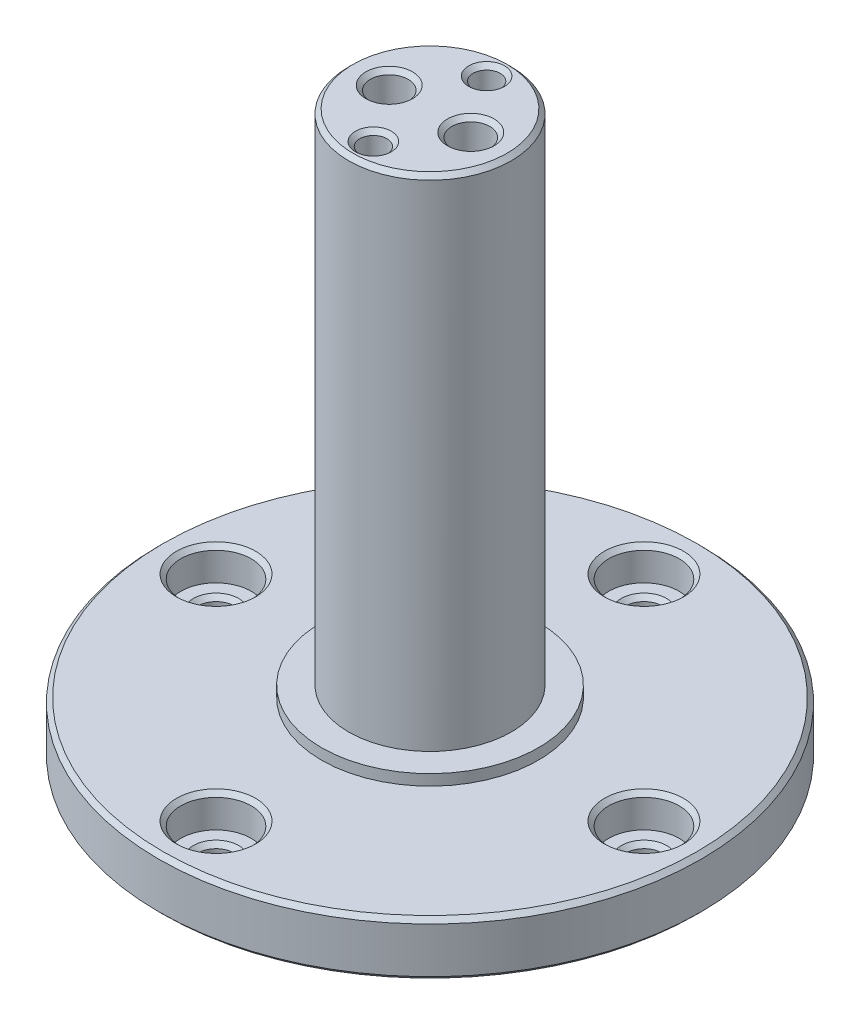
from build123d import *

# Parameters (mm, degrees)
CIRPATTERN1_COUNT                               = 4
CUT_EXTRUDE1_DEPTH                              = 47
SKETCH6_R                                       = 1.75
CUT_EXTRUDE2_DEPTH                              = 59.81326381
CSK_FOR_M3_FLAT_HEAD_MACHINE_SCREW1_D           = 2.5
CSK_FOR_M3_FLAT_HEAD_MACHINE_SCREW1_CSINK_D     = 6.5
CSK_FOR_M3_FLAT_HEAD_MACHINE_SCREW1_CSINK_ANGLE = 90
CHAMFER1_SIZE                                   = 0.4


# Some blends are built 0.0001 mm under size
with BuildPart() as part:
    # Sketch1 → Revolve1 (revolve)
    with BuildSketch(Plane.XY, mode=Mode.PRIVATE) as revolve1_sk:
        Polygon((0, 0), (25, 0), (25, 5), (10, 5), (10, 6), (7.5, 6), (7.5, 52), (0, 52), align=None)
    revolve(revolve1_sk.sketch.rotate(Axis((0, 52, 0), (0, -1, 0)), 90), axis=Axis((0, 52, 0), (0, -1, 0)))

    # Sketch4 → CBORE for M3 SHCS1 (revolve, cut)
    with BuildSketch(Plane(origin=(-19.7225, 5, 0), x_dir=(0, 0, 1), z_dir=(1, 0, 0))):
        Polygon((0, 0), (0, 5), (2.1, 5), (1.7, 4.6), (1.7, 3.4), (2.1, 3), (3.25, 3), (3.25, 0.4), (3.65, 0), align=None)
    cbore_for_m3_shcs1 = revolve(axis=Axis((-19.7225, 11.35, 0), (0, -1, 0)), mode=Mode.SUBTRACT)

    # CirPattern1: CBORE for M3 SHCS1 ×4 about axis
    cirpattern1_axis = Axis((0, 0, 0), (0, 1, 0))
    for i in range(1, CIRPATTERN1_COUNT):
        add(cbore_for_m3_shcs1.rotate(cirpattern1_axis, i * 360 / CIRPATTERN1_COUNT), mode=Mode.SUBTRACT)

    # Sketch5 → Cut-Extrude1 (cut)
    with BuildSketch(Plane.XZ):
        Polygon((-1.009160212, -1.58771324), (-1.009160212, 1.58771324), (-3.759160212, 3.175426481), (-6.509160212, 1.58771324), (-6.509160212, -1.58771324), (-3.759160212, -3.175426481), align=None)
        Polygon((3.759160212, 3.175426481), (1.009160212, 1.58771324), (1.009160212, -1.58771324), (3.759160212, -3.175426481), (6.509160212, -1.58771324), (6.509160212, 1.58771324), align=None)
    extrude(amount=-CUT_EXTRUDE1_DEPTH, mode=Mode.SUBTRACT)

    # Sketch6 → Cut-Extrude2 (cut, through all)
    with BuildSketch(Plane.XZ.offset(-47)):
        with Locations(Location((3.759160212, 0, 0), (0, 0, 270))):
            Circle(SKETCH6_R)
        with Locations(Location((-3.759160212, 0, 0), (0, 0, 270))):
            Circle(SKETCH6_R)
    extrude(amount=-CUT_EXTRUDE2_DEPTH, mode=Mode.SUBTRACT)

    # CSK for M3 Flat Head Machine Screw1 (through all)
    with Locations(Plane(origin=(0, 0, 0), x_dir=(-1, 0, 0), z_dir=(0, -1, 0))):
        with Locations((0, -5.219731285), (0, 5.219731285)):
            CounterSinkHole(CSK_FOR_M3_FLAT_HEAD_MACHINE_SCREW1_D / 2, CSK_FOR_M3_FLAT_HEAD_MACHINE_SCREW1_CSINK_D / 2, counter_sink_angle=CSK_FOR_M3_FLAT_HEAD_MACHINE_SCREW1_CSINK_ANGLE)

    # Chamfer1
    chamfer1_edges = [part.edges().sort_by_distance(p)[0] for p in [
        (-3.759160212, 52, 1.75),
        (-1.25, 52, -5.219731285),
        (-1.25, 52, 5.219731285),
        (-2.384160212, 0, -2.38156986),
        (0, 52, -7.5),
        (-1.009160212, 0, 0),
        (-2.384160212, 0, 2.38156986),
        (-5.134160212, 0, 2.38156986),
        (-6.509160212, 0, 0),
        (-5.134160212, 0, -2.38156986),
        (5.134160212, 0, 2.38156986),
        (2.384160212, 0, 2.38156986),
        (1.009160212, 0, 0),
        (2.384160212, 0, -2.38156986),
        (5.134160212, 0, -2.38156986),
        (6.509160212, 0, 0),
        (0, 5, -25),
        (0, 0, -25),
        (3.759160212, 52, 1.75),
    ]]
    chamfer(chamfer1_edges, length=CHAMFER1_SIZE - 0.0001)  # a hair under: the kernel refuses the full size

    # Chamfer2
    # the kernel refuses this chamfer: 1.6 mm, written as the material it adds along each edge
    with BuildSketch(Plane(origin=(-10.072588689, 47, 0.46963315), x_dir=(-0.013747938305293285, -0.9996219169112966, -0.02381212764409033), z_dir=(0.8660254037844386, 0, -0.5000000000000002))) as chamfer2_piece_1_section:
        with BuildLine():
            Line((1.645877112, 0), (-0.090475448, -1.64338847))
            Line((-0.090475448, -1.64338847), (-0.122463349, -1.642508602))
            ThreePointArc((-0.122463349, -1.642508602), (-0.054606763, -0.821436527), (-0.031987901, 0.000879868))
            Line((-0.031987901, 0.000879868), (0.000879868, 0.031987901))
            ThreePointArc((0.000879868, 0.031987901), (0.823196264, 0.009369039), (1.64675698, 0.031987901))
            Line((1.64675698, 0.031987901), (1.645877112, 0))
        make_face()
    chamfer2_piece_1 = extrude(amount=11.404812042, mode=Mode.PRIVATE)
    chamfer2_piece_1 = split(chamfer2_piece_1, bisect_by=Plane(origin=(-4.04949451, 46.473901725, -3.343051066), z_dir=(-0.49999999999999994, 0, 0.8660254037844389)), keep=Keep.TOP, mode=Mode.PRIVATE)
    chamfer2_piece_1 = split(chamfer2_piece_1, bisect_by=Plane(origin=(-6.509160212, 46.473901725, -1.922962404), z_dir=(1, 0, 0)), keep=Keep.TOP, mode=Mode.PRIVATE)
    chamfer2_piece_1 = chamfer2_piece_1 - Plane(origin=(-3.759160212, 46.473901725, 0), x_dir=(0, 0, -1), z_dir=(0, -1, 0)) * Cylinder(1.75, 30, mode=Mode.PRIVATE)
    add(chamfer2_piece_1)
    with BuildSketch(Plane(origin=(-6.509160212, 47, 5.702406021), x_dir=(-0.027495876610586223, -0.9996219169112966, 0), z_dir=(0, 0, -1))) as chamfer2_piece_2_section:
        with BuildLine():
            Line((1.645877112, 0), (-0.090475448, -1.64338847))
            Line((-0.090475448, -1.64338847), (-0.122463349, -1.642508602))
            ThreePointArc((-0.122463349, -1.642508602), (-0.054606763, -0.821436527), (-0.031987901, 0.000879868))
            Line((-0.031987901, 0.000879868), (0.000879868, 0.031987901))
            ThreePointArc((0.000879868, 0.031987901), (0.823196264, 0.009369039), (1.64675698, 0.031987901))
            Line((1.64675698, 0.031987901), (1.645877112, 0))
        make_face()
    chamfer2_piece_2 = extrude(amount=11.404812042, mode=Mode.PRIVATE)
    chamfer2_piece_2 = split(chamfer2_piece_2, bisect_by=Plane(origin=(-6.799494523, 46.473901712, -1.420088648), z_dir=(0.5000000000000002, 0, 0.8660254037844386)), keep=Keep.TOP, mode=Mode.PRIVATE)
    chamfer2_piece_2 = split(chamfer2_piece_2, bisect_by=Plane(origin=(-6.799494522, 46.473901712, 1.420088648), z_dir=(0.4999999999999998, 0, -0.8660254037844388)), keep=Keep.TOP, mode=Mode.PRIVATE)
    chamfer2_piece_2 = chamfer2_piece_2 - Plane(origin=(-3.759160212, 46.473901712, 0), x_dir=(0, 0, -1), z_dir=(0, -1, 0)) * Cylinder(1.75, 30, mode=Mode.PRIVATE)
    add(chamfer2_piece_2)
    with BuildSketch(Plane(origin=(-0.195731735, 47, 5.232772871), x_dir=(-0.01374793830529322, -0.9996219169112966, 0.023812127644090242), z_dir=(-0.8660254037844388, 0, -0.4999999999999998))) as chamfer2_piece_3_section:
        with BuildLine():
            Line((1.645877112, 0), (-0.090475448, -1.64338847))
            Line((-0.090475448, -1.64338847), (-0.122463349, -1.642508602))
            ThreePointArc((-0.122463349, -1.642508602), (-0.054606763, -0.821436527), (-0.031987901, 0.000879868))
            Line((-0.031987901, 0.000879868), (0.000879868, 0.031987901))
            ThreePointArc((0.000879868, 0.031987901), (0.823196264, 0.009369039), (1.64675698, 0.031987901))
            Line((1.64675698, 0.031987901), (1.645877112, 0))
        make_face()
    chamfer2_piece_3 = extrude(amount=11.404812042, mode=Mode.PRIVATE)
    chamfer2_piece_3 = split(chamfer2_piece_3, bisect_by=Plane(origin=(-6.509160212, 46.473901712, 1.922962425), z_dir=(1, 0, 0)), keep=Keep.TOP, mode=Mode.PRIVATE)
    chamfer2_piece_3 = split(chamfer2_piece_3, bisect_by=Plane(origin=(-4.049494522, 46.473901712, 3.343051072), z_dir=(-0.5000000000000003, 0, -0.8660254037844386)), keep=Keep.TOP, mode=Mode.PRIVATE)
    chamfer2_piece_3 = chamfer2_piece_3 - Plane(origin=(-3.759160212, 46.473901712, 0), x_dir=(0, 0, -1), z_dir=(0, -1, 0)) * Cylinder(1.75, 30, mode=Mode.PRIVATE)
    add(chamfer2_piece_3)
    with BuildSketch(Plane(origin=(-7.322588689, 47, -5.232772871), x_dir=(0.013747938305293349, -0.9996219169112966, -0.023812127644090457), z_dir=(0.8660254037844387, 0, 0.49999999999999983))) as chamfer2_piece_4_section:
        with BuildLine():
            Line((1.645877112, 0), (-0.090475448, -1.64338847))
            Line((-0.090475448, -1.64338847), (-0.122463349, -1.642508602))
            ThreePointArc((-0.122463349, -1.642508602), (-0.054606763, -0.821436527), (-0.031987901, 0.000879868))
            Line((-0.031987901, 0.000879868), (0.000879868, 0.031987901))
            ThreePointArc((0.000879868, 0.031987901), (0.823196264, 0.009369039), (1.64675698, 0.031987901))
            Line((1.64675698, 0.031987901), (1.645877112, 0))
        make_face()
    chamfer2_piece_4 = extrude(amount=11.404812042, mode=Mode.PRIVATE)
    chamfer2_piece_4 = split(chamfer2_piece_4, bisect_by=Plane(origin=(-3.468825909, 46.473901717, -3.343051069), z_dir=(0.5000000000000002, 0, 0.8660254037844386)), keep=Keep.TOP, mode=Mode.PRIVATE)
    chamfer2_piece_4 = split(chamfer2_piece_4, bisect_by=Plane(origin=(-1.009160212, 46.473901717, -1.922962418), z_dir=(-1, 0, 0)), keep=Keep.TOP, mode=Mode.PRIVATE)
    chamfer2_piece_4 = chamfer2_piece_4 - Plane(origin=(-3.759160212, 46.473901717, 0), x_dir=(0, 0, -1), z_dir=(0, -1, 0)) * Cylinder(1.75, 30, mode=Mode.PRIVATE)
    add(chamfer2_piece_4)
    with BuildSketch(Plane(origin=(2.554268265, 47, -0.46963315), x_dir=(0.013747938305293157, -0.9996219169112966, 0.0238121276440901), z_dir=(-0.8660254037844386, 0, 0.5000000000000003))) as chamfer2_piece_5_section:
        with BuildLine():
            Line((1.645877112, 0), (-0.090475448, -1.64338847))
            Line((-0.090475448, -1.64338847), (-0.122463349, -1.642508602))
            ThreePointArc((-0.122463349, -1.642508602), (-0.054606763, -0.821436527), (-0.031987901, 0.000879868))
            Line((-0.031987901, 0.000879868), (0.000879868, 0.031987901))
            ThreePointArc((0.000879868, 0.031987901), (0.823196264, 0.009369039), (1.64675698, 0.031987901))
            Line((1.64675698, 0.031987901), (1.645877112, 0))
        make_face()
    chamfer2_piece_5 = extrude(amount=11.404812042, mode=Mode.PRIVATE)
    chamfer2_piece_5 = split(chamfer2_piece_5, bisect_by=Plane(origin=(-1.009160212, 46.473901712, 1.922962424), z_dir=(-1, 0, 0)), keep=Keep.TOP, mode=Mode.PRIVATE)
    chamfer2_piece_5 = split(chamfer2_piece_5, bisect_by=Plane(origin=(-3.468825902, 46.473901712, 3.343051073), z_dir=(0.4999999999999998, 0, -0.8660254037844388)), keep=Keep.TOP, mode=Mode.PRIVATE)
    chamfer2_piece_5 = chamfer2_piece_5 - Plane(origin=(-3.759160212, 46.473901712, 0), x_dir=(0, 0, -1), z_dir=(0, -1, 0)) * Cylinder(1.75, 30, mode=Mode.PRIVATE)
    add(chamfer2_piece_5)
    with BuildSketch(Plane(origin=(-1.009160212, 47, -5.702406021), x_dir=(0.02749587661058629, -0.9996219169112966, 0), z_dir=(0, 0, 1))) as chamfer2_piece_6_section:
        with BuildLine():
            Line((1.645877112, 0), (-0.090475448, -1.64338847))
            Line((-0.090475448, -1.64338847), (-0.122463349, -1.642508602))
            ThreePointArc((-0.122463349, -1.642508602), (-0.054606763, -0.821436527), (-0.031987901, 0.000879868))
            Line((-0.031987901, 0.000879868), (0.000879868, 0.031987901))
            ThreePointArc((0.000879868, 0.031987901), (0.823196264, 0.009369039), (1.64675698, 0.031987901))
            Line((1.64675698, 0.031987901), (1.645877112, 0))
        make_face()
    chamfer2_piece_6 = extrude(amount=11.404812042, mode=Mode.PRIVATE)
    chamfer2_piece_6 = split(chamfer2_piece_6, bisect_by=Plane(origin=(-0.718825902, 46.473901712, -1.420088648), z_dir=(-0.49999999999999994, 0, 0.8660254037844389)), keep=Keep.TOP, mode=Mode.PRIVATE)
    chamfer2_piece_6 = split(chamfer2_piece_6, bisect_by=Plane(origin=(-0.718825902, 46.473901712, 1.420088648), z_dir=(-0.5000000000000003, 0, -0.8660254037844386)), keep=Keep.TOP, mode=Mode.PRIVATE)
    chamfer2_piece_6 = chamfer2_piece_6 - Plane(origin=(-3.759160212, 46.473901712, 0), x_dir=(0, 0, -1), z_dir=(0, -1, 0)) * Cylinder(1.75, 30, mode=Mode.PRIVATE)
    add(chamfer2_piece_6)
    with BuildSketch(Plane(origin=(1.009160212, 47, 5.702406021), x_dir=(-0.02749587661058629, -0.9996219169112966, 0), z_dir=(0, 0, -1))) as chamfer2_piece_7_section:
        with BuildLine():
            Line((1.645877112, 0), (-0.090475448, -1.64338847))
            Line((-0.090475448, -1.64338847), (-0.122463349, -1.642508602))
            ThreePointArc((-0.122463349, -1.642508602), (-0.054606763, -0.821436527), (-0.031987901, 0.000879868))
            Line((-0.031987901, 0.000879868), (0.000879868, 0.031987901))
            ThreePointArc((0.000879868, 0.031987901), (0.823196264, 0.009369039), (1.64675698, 0.031987901))
            Line((1.64675698, 0.031987901), (1.645877112, 0))
        make_face()
    chamfer2_piece_7 = extrude(amount=11.404812042, mode=Mode.PRIVATE)
    chamfer2_piece_7 = split(chamfer2_piece_7, bisect_by=Plane(origin=(0.718825902, 46.473901712, 1.420088648), z_dir=(0.49999999999999967, 0, -0.8660254037844388)), keep=Keep.TOP, mode=Mode.PRIVATE)
    chamfer2_piece_7 = split(chamfer2_piece_7, bisect_by=Plane(origin=(0.718825902, 46.473901712, -1.420088648), z_dir=(0.5000000000000003, 0, 0.8660254037844385)), keep=Keep.TOP, mode=Mode.PRIVATE)
    chamfer2_piece_7 = chamfer2_piece_7 - Plane(origin=(3.759160212, 46.473901712, 0), x_dir=(0, 0, -1), z_dir=(0, -1, 0)) * Cylinder(1.75, 30, mode=Mode.PRIVATE)
    add(chamfer2_piece_7)
    with BuildSketch(Plane(origin=(7.322588689, 47, 5.232772871), x_dir=(-0.013747938305293347, -0.9996219169112966, 0.023812127644090464), z_dir=(-0.8660254037844389, 0, -0.4999999999999998))) as chamfer2_piece_8_section:
        with BuildLine():
            Line((1.645877112, 0), (-0.090475448, -1.64338847))
            Line((-0.090475448, -1.64338847), (-0.122463349, -1.642508602))
            ThreePointArc((-0.122463349, -1.642508602), (-0.054606763, -0.821436527), (-0.031987901, 0.000879868))
            Line((-0.031987901, 0.000879868), (0.000879868, 0.031987901))
            ThreePointArc((0.000879868, 0.031987901), (0.823196264, 0.009369039), (1.64675698, 0.031987901))
            Line((1.64675698, 0.031987901), (1.645877112, 0))
        make_face()
    chamfer2_piece_8 = extrude(amount=11.404812042, mode=Mode.PRIVATE)
    chamfer2_piece_8 = split(chamfer2_piece_8, bisect_by=Plane(origin=(3.468825902, 46.473901712, 3.343051072), z_dir=(-0.5000000000000002, 0, -0.8660254037844386)), keep=Keep.TOP, mode=Mode.PRIVATE)
    chamfer2_piece_8 = split(chamfer2_piece_8, bisect_by=Plane(origin=(1.009160212, 46.473901712, 1.922962425), z_dir=(1, 0, 0)), keep=Keep.TOP, mode=Mode.PRIVATE)
    chamfer2_piece_8 = chamfer2_piece_8 - Plane(origin=(3.759160212, 46.473901712, 0), x_dir=(0, 0, -1), z_dir=(0, -1, 0)) * Cylinder(1.75, 30, mode=Mode.PRIVATE)
    add(chamfer2_piece_8)
    with BuildSketch(Plane(origin=(10.072588689, 47, -0.46963315), x_dir=(0.01374793830529317, -0.9996219169112966, 0.023812127644090124), z_dir=(-0.8660254037844386, 0, 0.5000000000000002))) as chamfer2_piece_9_section:
        with BuildLine():
            Line((1.645877112, 0), (-0.090475448, -1.64338847))
            Line((-0.090475448, -1.64338847), (-0.122463349, -1.642508602))
            ThreePointArc((-0.122463349, -1.642508602), (-0.054606763, -0.821436527), (-0.031987901, 0.000879868))
            Line((-0.031987901, 0.000879868), (0.000879868, 0.031987901))
            ThreePointArc((0.000879868, 0.031987901), (0.823196264, 0.009369039), (1.64675698, 0.031987901))
            Line((1.64675698, 0.031987901), (1.645877112, 0))
        make_face()
    chamfer2_piece_9 = extrude(amount=11.404812042, mode=Mode.PRIVATE)
    chamfer2_piece_9 = split(chamfer2_piece_9, bisect_by=Plane(origin=(6.509160212, 46.473901712, 1.922962424), z_dir=(-1, 0, 0)), keep=Keep.TOP, mode=Mode.PRIVATE)
    chamfer2_piece_9 = split(chamfer2_piece_9, bisect_by=Plane(origin=(4.049494523, 46.473901712, 3.343051073), z_dir=(0.49999999999999967, 0, -0.8660254037844388)), keep=Keep.TOP, mode=Mode.PRIVATE)
    chamfer2_piece_9 = chamfer2_piece_9 - Plane(origin=(3.759160212, 46.473901712, 0), x_dir=(0, 0, -1), z_dir=(0, -1, 0)) * Cylinder(1.75, 30, mode=Mode.PRIVATE)
    add(chamfer2_piece_9)
    with BuildSketch(Plane(origin=(6.509160212, 47, -5.702406021), x_dir=(0.027495876610586223, -0.9996219169112966, 0), z_dir=(0, 0, 1))) as chamfer2_piece_10_section:
        with BuildLine():
            Line((1.645877112, 0), (-0.090475448, -1.64338847))
            Line((-0.090475448, -1.64338847), (-0.122463349, -1.642508602))
            ThreePointArc((-0.122463349, -1.642508602), (-0.054606763, -0.821436527), (-0.031987901, 0.000879868))
            Line((-0.031987901, 0.000879868), (0.000879868, 0.031987901))
            ThreePointArc((0.000879868, 0.031987901), (0.823196264, 0.009369039), (1.64675698, 0.031987901))
            Line((1.64675698, 0.031987901), (1.645877112, 0))
        make_face()
    chamfer2_piece_10 = extrude(amount=11.404812042, mode=Mode.PRIVATE)
    chamfer2_piece_10 = split(chamfer2_piece_10, bisect_by=Plane(origin=(6.799494523, 46.473901712, 1.420088648), z_dir=(-0.5000000000000002, 0, -0.8660254037844386)), keep=Keep.TOP, mode=Mode.PRIVATE)
    chamfer2_piece_10 = split(chamfer2_piece_10, bisect_by=Plane(origin=(6.799494522, 46.473901712, -1.420088648), z_dir=(-0.49999999999999967, 0, 0.8660254037844389)), keep=Keep.TOP, mode=Mode.PRIVATE)
    chamfer2_piece_10 = chamfer2_piece_10 - Plane(origin=(3.759160212, 46.473901712, 0), x_dir=(0, 0, -1), z_dir=(0, -1, 0)) * Cylinder(1.75, 30, mode=Mode.PRIVATE)
    add(chamfer2_piece_10)
    with BuildSketch(Plane(origin=(0.195731735, 47, -5.232772871), x_dir=(0.013747938305293082, -0.9996219169112966, -0.023812127644090013), z_dir=(0.8660254037844389, 0, 0.49999999999999967))) as chamfer2_piece_11_section:
        with BuildLine():
            Line((1.645877112, 0), (-0.090475448, -1.64338847))
            Line((-0.090475448, -1.64338847), (-0.122463349, -1.642508602))
            ThreePointArc((-0.122463349, -1.642508602), (-0.054606763, -0.821436527), (-0.031987901, 0.000879868))
            Line((-0.031987901, 0.000879868), (0.000879868, 0.031987901))
            ThreePointArc((0.000879868, 0.031987901), (0.823196264, 0.009369039), (1.64675698, 0.031987901))
            Line((1.64675698, 0.031987901), (1.645877112, 0))
        make_face()
    chamfer2_piece_11 = extrude(amount=11.404812042, mode=Mode.PRIVATE)
    chamfer2_piece_11 = split(chamfer2_piece_11, bisect_by=Plane(origin=(6.509160212, 46.473901717, -1.922962418), z_dir=(-1, 0, 0)), keep=Keep.TOP, mode=Mode.PRIVATE)
    chamfer2_piece_11 = split(chamfer2_piece_11, bisect_by=Plane(origin=(4.049494515, 46.473901717, -3.343051069), z_dir=(0.5000000000000003, 0, 0.8660254037844385)), keep=Keep.TOP, mode=Mode.PRIVATE)
    chamfer2_piece_11 = chamfer2_piece_11 - Plane(origin=(3.759160212, 46.473901717, 0), x_dir=(0, 0, -1), z_dir=(0, -1, 0)) * Cylinder(1.75, 30, mode=Mode.PRIVATE)
    add(chamfer2_piece_11)
    with BuildSketch(Plane(origin=(-2.554268265, 47, 0.46963315), x_dir=(-0.013747938305293155, -0.9996219169112966, -0.023812127644090093), z_dir=(0.8660254037844385, 0, -0.5000000000000003))) as chamfer2_piece_12_section:
        with BuildLine():
            Line((1.645877112, 0), (-0.090475448, -1.64338847))
            Line((-0.090475448, -1.64338847), (-0.122463349, -1.642508602))
            ThreePointArc((-0.122463349, -1.642508602), (-0.054606763, -0.821436527), (-0.031987901, 0.000879868))
            Line((-0.031987901, 0.000879868), (0.000879868, 0.031987901))
            ThreePointArc((0.000879868, 0.031987901), (0.823196264, 0.009369039), (1.64675698, 0.031987901))
            Line((1.64675698, 0.031987901), (1.645877112, 0))
        make_face()
    chamfer2_piece_12 = extrude(amount=11.404812042, mode=Mode.PRIVATE)
    chamfer2_piece_12 = split(chamfer2_piece_12, bisect_by=Plane(origin=(3.468825914, 46.473901725, -3.343051066), z_dir=(-0.49999999999999967, 0, 0.8660254037844389)), keep=Keep.TOP, mode=Mode.PRIVATE)
    chamfer2_piece_12 = split(chamfer2_piece_12, bisect_by=Plane(origin=(1.009160212, 46.473901725, -1.922962404), z_dir=(1, 0, 0)), keep=Keep.TOP, mode=Mode.PRIVATE)
    chamfer2_piece_12 = chamfer2_piece_12 - Plane(origin=(3.759160212, 46.473901725, 0), x_dir=(0, 0, -1), z_dir=(0, -1, 0)) * Cylinder(1.75, 30, mode=Mode.PRIVATE)
    add(chamfer2_piece_12)
    with BuildSketch(Plane(origin=(-10.072588689, 47, 0.46963315), x_dir=(-0.013747938305293285, -0.9996219169112966, -0.02381212764409033), z_dir=(0.8660254037844386, 0, -0.5000000000000002))) as chamfer2_piece_13a_section:
        with BuildLine():
            Line((1.645877112, 0), (-0.090475448, -1.64338847))
            Line((-0.090475448, -1.64338847), (-0.122463349, -1.642508602))
            ThreePointArc((-0.122463349, -1.642508602), (-0.054606763, -0.821436527), (-0.031987901, 0.000879868))
            Line((-0.031987901, 0.000879868), (0.000879868, 0.031987901))
            ThreePointArc((0.000879868, 0.031987901), (0.823196264, 0.009369039), (1.64675698, 0.031987901))
            Line((1.64675698, 0.031987901), (1.645877112, 0))
        make_face()
    chamfer2_piece_13a = extrude(amount=11.404812042, mode=Mode.PRIVATE)
    chamfer2_piece_13a = split(chamfer2_piece_13a, bisect_by=Plane(origin=(-6.509160212, 46.459160582, -0.050791623), z_dir=(-1, 0, 0)), keep=Keep.TOP, mode=Mode.PRIVATE)
    with BuildSketch(Plane(origin=(-6.509160212, 47, 5.702406021), x_dir=(-0.027495876610586223, -0.9996219169112966, 0), z_dir=(0, 0, -1))) as chamfer2_piece_13b_section:
        with BuildLine():
            Line((1.645877112, 0), (-0.090475448, -1.64338847))
            Line((-0.090475448, -1.64338847), (-0.122463349, -1.642508602))
            ThreePointArc((-0.122463349, -1.642508602), (-0.054606763, -0.821436527), (-0.031987901, 0.000879868))
            Line((-0.031987901, 0.000879868), (0.000879868, 0.031987901))
            ThreePointArc((0.000879868, 0.031987901), (0.823196264, 0.009369039), (1.64675698, 0.031987901))
            Line((1.64675698, 0.031987901), (1.645877112, 0))
        make_face()
    chamfer2_piece_13b = extrude(amount=11.404812042, mode=Mode.PRIVATE)
    chamfer2_piece_13b = split(chamfer2_piece_13b, bisect_by=Plane(origin=(-5.178147048, 46.459160582, -2.356174049), z_dir=(-0.5000000000000002, 0, -0.8660254037844386)), keep=Keep.TOP, mode=Mode.PRIVATE)
    chamfer2_piece_13 = chamfer2_piece_13a & chamfer2_piece_13b
    add(chamfer2_piece_13)
    with BuildSketch(Plane(origin=(-7.322588689, 47, -5.232772871), x_dir=(0.013747938305293349, -0.9996219169112966, -0.023812127644090457), z_dir=(0.8660254037844387, 0, 0.49999999999999983))) as chamfer2_piece_14a_section:
        with BuildLine():
            Line((1.645877112, 0), (-0.090475448, -1.64338847))
            Line((-0.090475448, -1.64338847), (-0.122463349, -1.642508602))
            ThreePointArc((-0.122463349, -1.642508602), (-0.054606763, -0.821436527), (-0.031987901, 0.000879868))
            Line((-0.031987901, 0.000879868), (0.000879868, 0.031987901))
            ThreePointArc((0.000879868, 0.031987901), (0.823196264, 0.009369039), (1.64675698, 0.031987901))
            Line((1.64675698, 0.031987901), (1.645877112, 0))
        make_face()
    chamfer2_piece_14a = extrude(amount=11.404812042, mode=Mode.PRIVATE)
    chamfer2_piece_14a = split(chamfer2_piece_14a, bisect_by=Plane(origin=(-5.090173376, 46.459160582, -2.406965672), z_dir=(-0.5000000000000002, 0, -0.8660254037844386)), keep=Keep.TOP, mode=Mode.PRIVATE)
    with BuildSketch(Plane(origin=(-10.072588689, 47, 0.46963315), x_dir=(-0.013747938305293285, -0.9996219169112966, -0.02381212764409033), z_dir=(0.8660254037844386, 0, -0.5000000000000002))) as chamfer2_piece_14b_section:
        with BuildLine():
            Line((1.645877112, 0), (-0.090475448, -1.64338847))
            Line((-0.090475448, -1.64338847), (-0.122463349, -1.642508602))
            ThreePointArc((-0.122463349, -1.642508602), (-0.054606763, -0.821436527), (-0.031987901, 0.000879868))
            Line((-0.031987901, 0.000879868), (0.000879868, 0.031987901))
            ThreePointArc((0.000879868, 0.031987901), (0.823196264, 0.009369039), (1.64675698, 0.031987901))
            Line((1.64675698, 0.031987901), (1.645877112, 0))
        make_face()
    chamfer2_piece_14b = extrude(amount=11.404812042, mode=Mode.PRIVATE)
    chamfer2_piece_14b = split(chamfer2_piece_14b, bisect_by=Plane(origin=(-2.428147048, 46.459160582, -2.406965672), z_dir=(0.49999999999999994, 0, -0.8660254037844389)), keep=Keep.TOP, mode=Mode.PRIVATE)
    chamfer2_piece_14 = chamfer2_piece_14a & chamfer2_piece_14b
    add(chamfer2_piece_14)
    with BuildSketch(Plane(origin=(-6.509160212, 47, 5.702406021), x_dir=(-0.027495876610586223, -0.9996219169112966, 0), z_dir=(0, 0, -1))) as chamfer2_piece_15a_section:
        with BuildLine():
            Line((1.645877112, 0), (-0.090475448, -1.64338847))
            Line((-0.090475448, -1.64338847), (-0.122463349, -1.642508602))
            ThreePointArc((-0.122463349, -1.642508602), (-0.054606763, -0.821436527), (-0.031987901, 0.000879868))
            Line((-0.031987901, 0.000879868), (0.000879868, 0.031987901))
            ThreePointArc((0.000879868, 0.031987901), (0.823196264, 0.009369039), (1.64675698, 0.031987901))
            Line((1.64675698, 0.031987901), (1.645877112, 0))
        make_face()
    chamfer2_piece_15a = extrude(amount=11.404812042, mode=Mode.PRIVATE)
    chamfer2_piece_15a = split(chamfer2_piece_15a, bisect_by=Plane(origin=(-5.178147048, 46.459160582, 2.356174049), z_dir=(-0.4999999999999998, 0, 0.8660254037844388)), keep=Keep.TOP, mode=Mode.PRIVATE)
    with BuildSketch(Plane(origin=(-0.195731735, 47, 5.232772871), x_dir=(-0.01374793830529322, -0.9996219169112966, 0.023812127644090242), z_dir=(-0.8660254037844388, 0, -0.4999999999999998))) as chamfer2_piece_15b_section:
        with BuildLine():
            Line((1.645877112, 0), (-0.090475448, -1.64338847))
            Line((-0.090475448, -1.64338847), (-0.122463349, -1.642508602))
            ThreePointArc((-0.122463349, -1.642508602), (-0.054606763, -0.821436527), (-0.031987901, 0.000879868))
            Line((-0.031987901, 0.000879868), (0.000879868, 0.031987901))
            ThreePointArc((0.000879868, 0.031987901), (0.823196264, 0.009369039), (1.64675698, 0.031987901))
            Line((1.64675698, 0.031987901), (1.645877112, 0))
        make_face()
    chamfer2_piece_15b = extrude(amount=11.404812042, mode=Mode.PRIVATE)
    chamfer2_piece_15b = split(chamfer2_piece_15b, bisect_by=Plane(origin=(-6.509160212, 46.459160582, 0.050791623), z_dir=(-1, 0, 0)), keep=Keep.TOP, mode=Mode.PRIVATE)
    chamfer2_piece_15 = chamfer2_piece_15a & chamfer2_piece_15b
    add(chamfer2_piece_15)
    with BuildSketch(Plane(origin=(2.554268265, 47, -0.46963315), x_dir=(0.013747938305293157, -0.9996219169112966, 0.0238121276440901), z_dir=(-0.8660254037844386, 0, 0.5000000000000003))) as chamfer2_piece_16a_section:
        with BuildLine():
            Line((1.645877112, 0), (-0.090475448, -1.64338847))
            Line((-0.090475448, -1.64338847), (-0.122463349, -1.642508602))
            ThreePointArc((-0.122463349, -1.642508602), (-0.054606763, -0.821436527), (-0.031987901, 0.000879868))
            Line((-0.031987901, 0.000879868), (0.000879868, 0.031987901))
            ThreePointArc((0.000879868, 0.031987901), (0.823196264, 0.009369039), (1.64675698, 0.031987901))
            Line((1.64675698, 0.031987901), (1.645877112, 0))
        make_face()
    chamfer2_piece_16a = extrude(amount=11.404812042, mode=Mode.PRIVATE)
    chamfer2_piece_16a = split(chamfer2_piece_16a, bisect_by=Plane(origin=(-5.090173376, 46.459160582, 2.406965672), z_dir=(-0.4999999999999998, 0, 0.8660254037844388)), keep=Keep.TOP, mode=Mode.PRIVATE)
    with BuildSketch(Plane(origin=(-0.195731735, 47, 5.232772871), x_dir=(-0.01374793830529322, -0.9996219169112966, 0.023812127644090242), z_dir=(-0.8660254037844388, 0, -0.4999999999999998))) as chamfer2_piece_16b_section:
        with BuildLine():
            Line((1.645877112, 0), (-0.090475448, -1.64338847))
            Line((-0.090475448, -1.64338847), (-0.122463349, -1.642508602))
            ThreePointArc((-0.122463349, -1.642508602), (-0.054606763, -0.821436527), (-0.031987901, 0.000879868))
            Line((-0.031987901, 0.000879868), (0.000879868, 0.031987901))
            ThreePointArc((0.000879868, 0.031987901), (0.823196264, 0.009369039), (1.64675698, 0.031987901))
            Line((1.64675698, 0.031987901), (1.645877112, 0))
        make_face()
    chamfer2_piece_16b = extrude(amount=11.404812042, mode=Mode.PRIVATE)
    chamfer2_piece_16b = split(chamfer2_piece_16b, bisect_by=Plane(origin=(-2.428147048, 46.459160582, 2.406965672), z_dir=(0.5000000000000003, 0, 0.8660254037844386)), keep=Keep.TOP, mode=Mode.PRIVATE)
    chamfer2_piece_16 = chamfer2_piece_16a & chamfer2_piece_16b
    add(chamfer2_piece_16)
    with BuildSketch(Plane(origin=(-7.322588689, 47, -5.232772871), x_dir=(0.013747938305293349, -0.9996219169112966, -0.023812127644090457), z_dir=(0.8660254037844387, 0, 0.49999999999999983))) as chamfer2_piece_17a_section:
        with BuildLine():
            Line((1.645877112, 0), (-0.090475448, -1.64338847))
            Line((-0.090475448, -1.64338847), (-0.122463349, -1.642508602))
            ThreePointArc((-0.122463349, -1.642508602), (-0.054606763, -0.821436527), (-0.031987901, 0.000879868))
            Line((-0.031987901, 0.000879868), (0.000879868, 0.031987901))
            ThreePointArc((0.000879868, 0.031987901), (0.823196264, 0.009369039), (1.64675698, 0.031987901))
            Line((1.64675698, 0.031987901), (1.645877112, 0))
        make_face()
    chamfer2_piece_17a = extrude(amount=11.404812042, mode=Mode.PRIVATE)
    chamfer2_piece_17a = split(chamfer2_piece_17a, bisect_by=Plane(origin=(-1.009160212, 46.471136406, -0.084946187), z_dir=(1, 0, 0)), keep=Keep.TOP, mode=Mode.PRIVATE)
    chamfer2_piece_17a = chamfer2_piece_17a - Plane(origin=(3.759160212, 46.471136406, 0), x_dir=(0, 0, -1), z_dir=(0, -1, 0)) * Cylinder(1.75, 30, mode=Mode.PRIVATE)
    with BuildSketch(Plane(origin=(-1.009160212, 47, -5.702406021), x_dir=(0.02749587661058629, -0.9996219169112966, 0), z_dir=(0, 0, 1))) as chamfer2_piece_17b_section:
        with BuildLine():
            Line((1.645877112, 0), (-0.090475448, -1.64338847))
            Line((-0.090475448, -1.64338847), (-0.122463349, -1.642508602))
            ThreePointArc((-0.122463349, -1.642508602), (-0.054606763, -0.821436527), (-0.031987901, 0.000879868))
            Line((-0.031987901, 0.000879868), (0.000879868, 0.031987901))
            ThreePointArc((0.000879868, 0.031987901), (0.823196264, 0.009369039), (1.64675698, 0.031987901))
            Line((1.64675698, 0.031987901), (1.645877112, 0))
        make_face()
    chamfer2_piece_17b = extrude(amount=11.404812042, mode=Mode.PRIVATE)
    chamfer2_piece_17b = split(chamfer2_piece_17b, bisect_by=Plane(origin=(-2.340173376, 46.459160582, -2.356174049), z_dir=(0.49999999999999994, 0, -0.8660254037844389)), keep=Keep.TOP, mode=Mode.PRIVATE)
    chamfer2_piece_17 = chamfer2_piece_17a & chamfer2_piece_17b
    add(chamfer2_piece_17)
    with BuildSketch(Plane(origin=(-1.009160212, 47, -5.702406021), x_dir=(0.02749587661058629, -0.9996219169112966, 0), z_dir=(0, 0, 1))) as chamfer2_piece_18a_section:
        with BuildLine():
            Line((1.645877112, 0), (-0.090475448, -1.64338847))
            Line((-0.090475448, -1.64338847), (-0.122463349, -1.642508602))
            ThreePointArc((-0.122463349, -1.642508602), (-0.054606763, -0.821436527), (-0.031987901, 0.000879868))
            Line((-0.031987901, 0.000879868), (0.000879868, 0.031987901))
            ThreePointArc((0.000879868, 0.031987901), (0.823196264, 0.009369039), (1.64675698, 0.031987901))
            Line((1.64675698, 0.031987901), (1.645877112, 0))
        make_face()
    chamfer2_piece_18a = extrude(amount=11.404812042, mode=Mode.PRIVATE)
    chamfer2_piece_18a = split(chamfer2_piece_18a, bisect_by=Plane(origin=(-2.340173376, 46.459160582, 2.356174049), z_dir=(0.5000000000000003, 0, 0.8660254037844386)), keep=Keep.TOP, mode=Mode.PRIVATE)
    with BuildSketch(Plane(origin=(2.554268265, 47, -0.46963315), x_dir=(0.013747938305293157, -0.9996219169112966, 0.0238121276440901), z_dir=(-0.8660254037844386, 0, 0.5000000000000003))) as chamfer2_piece_18b_section:
        with BuildLine():
            Line((1.645877112, 0), (-0.090475448, -1.64338847))
            Line((-0.090475448, -1.64338847), (-0.122463349, -1.642508602))
            ThreePointArc((-0.122463349, -1.642508602), (-0.054606763, -0.821436527), (-0.031987901, 0.000879868))
            Line((-0.031987901, 0.000879868), (0.000879868, 0.031987901))
            ThreePointArc((0.000879868, 0.031987901), (0.823196264, 0.009369039), (1.64675698, 0.031987901))
            Line((1.64675698, 0.031987901), (1.645877112, 0))
        make_face()
    chamfer2_piece_18b = extrude(amount=11.404812042, mode=Mode.PRIVATE)
    chamfer2_piece_18b = split(chamfer2_piece_18b, bisect_by=Plane(origin=(-1.009160212, 46.471136408, 0.08494619), z_dir=(1, 0, 0)), keep=Keep.TOP, mode=Mode.PRIVATE)
    chamfer2_piece_18b = chamfer2_piece_18b - Plane(origin=(3.759160212, 46.471136408, 0), x_dir=(0, 0, -1), z_dir=(0, -1, 0)) * Cylinder(1.75, 30, mode=Mode.PRIVATE)
    chamfer2_piece_18 = chamfer2_piece_18a & chamfer2_piece_18b
    add(chamfer2_piece_18)
    with BuildSketch(Plane(origin=(7.322588689, 47, 5.232772871), x_dir=(-0.013747938305293347, -0.9996219169112966, 0.023812127644090464), z_dir=(-0.8660254037844389, 0, -0.4999999999999998))) as chamfer2_piece_19a_section:
        with BuildLine():
            Line((1.645877112, 0), (-0.090475448, -1.64338847))
            Line((-0.090475448, -1.64338847), (-0.122463349, -1.642508602))
            ThreePointArc((-0.122463349, -1.642508602), (-0.054606763, -0.821436527), (-0.031987901, 0.000879868))
            Line((-0.031987901, 0.000879868), (0.000879868, 0.031987901))
            ThreePointArc((0.000879868, 0.031987901), (0.823196264, 0.009369039), (1.64675698, 0.031987901))
            Line((1.64675698, 0.031987901), (1.645877112, 0))
        make_face()
    chamfer2_piece_19a = extrude(amount=11.404812042, mode=Mode.PRIVATE)
    chamfer2_piece_19a = split(chamfer2_piece_19a, bisect_by=Plane(origin=(1.009160212, 46.471136406, 0.084946187), z_dir=(-1, 0, 0)), keep=Keep.TOP, mode=Mode.PRIVATE)
    chamfer2_piece_19a = chamfer2_piece_19a - Plane(origin=(-3.759160212, 46.471136406, 0), x_dir=(0, 0, -1), z_dir=(0, -1, 0)) * Cylinder(1.75, 30, mode=Mode.PRIVATE)
    with BuildSketch(Plane(origin=(1.009160212, 47, 5.702406021), x_dir=(-0.02749587661058629, -0.9996219169112966, 0), z_dir=(0, 0, -1))) as chamfer2_piece_19b_section:
        with BuildLine():
            Line((1.645877112, 0), (-0.090475448, -1.64338847))
            Line((-0.090475448, -1.64338847), (-0.122463349, -1.642508602))
            ThreePointArc((-0.122463349, -1.642508602), (-0.054606763, -0.821436527), (-0.031987901, 0.000879868))
            Line((-0.031987901, 0.000879868), (0.000879868, 0.031987901))
            ThreePointArc((0.000879868, 0.031987901), (0.823196264, 0.009369039), (1.64675698, 0.031987901))
            Line((1.64675698, 0.031987901), (1.645877112, 0))
        make_face()
    chamfer2_piece_19b = extrude(amount=11.404812042, mode=Mode.PRIVATE)
    chamfer2_piece_19b = split(chamfer2_piece_19b, bisect_by=Plane(origin=(2.340173376, 46.459160582, 2.356174049), z_dir=(-0.49999999999999967, 0, 0.8660254037844388)), keep=Keep.TOP, mode=Mode.PRIVATE)
    chamfer2_piece_19 = chamfer2_piece_19a & chamfer2_piece_19b
    add(chamfer2_piece_19)
    with BuildSketch(Plane(origin=(1.009160212, 47, 5.702406021), x_dir=(-0.02749587661058629, -0.9996219169112966, 0), z_dir=(0, 0, -1))) as chamfer2_piece_20a_section:
        with BuildLine():
            Line((1.645877112, 0), (-0.090475448, -1.64338847))
            Line((-0.090475448, -1.64338847), (-0.122463349, -1.642508602))
            ThreePointArc((-0.122463349, -1.642508602), (-0.054606763, -0.821436527), (-0.031987901, 0.000879868))
            Line((-0.031987901, 0.000879868), (0.000879868, 0.031987901))
            ThreePointArc((0.000879868, 0.031987901), (0.823196264, 0.009369039), (1.64675698, 0.031987901))
            Line((1.64675698, 0.031987901), (1.645877112, 0))
        make_face()
    chamfer2_piece_20a = extrude(amount=11.404812042, mode=Mode.PRIVATE)
    chamfer2_piece_20a = split(chamfer2_piece_20a, bisect_by=Plane(origin=(2.340173376, 46.459160582, -2.356174049), z_dir=(-0.5000000000000003, 0, -0.8660254037844385)), keep=Keep.TOP, mode=Mode.PRIVATE)
    with BuildSketch(Plane(origin=(-2.554268265, 47, 0.46963315), x_dir=(-0.013747938305293155, -0.9996219169112966, -0.023812127644090093), z_dir=(0.8660254037844385, 0, -0.5000000000000003))) as chamfer2_piece_20b_section:
        with BuildLine():
            Line((1.645877112, 0), (-0.090475448, -1.64338847))
            Line((-0.090475448, -1.64338847), (-0.122463349, -1.642508602))
            ThreePointArc((-0.122463349, -1.642508602), (-0.054606763, -0.821436527), (-0.031987901, 0.000879868))
            Line((-0.031987901, 0.000879868), (0.000879868, 0.031987901))
            ThreePointArc((0.000879868, 0.031987901), (0.823196264, 0.009369039), (1.64675698, 0.031987901))
            Line((1.64675698, 0.031987901), (1.645877112, 0))
        make_face()
    chamfer2_piece_20b = extrude(amount=11.404812042, mode=Mode.PRIVATE)
    chamfer2_piece_20b = split(chamfer2_piece_20b, bisect_by=Plane(origin=(1.009160212, 46.471136408, -0.08494619), z_dir=(-1, 0, 0)), keep=Keep.TOP, mode=Mode.PRIVATE)
    chamfer2_piece_20b = chamfer2_piece_20b - Plane(origin=(-3.759160212, 46.471136408, 0), x_dir=(0, 0, -1), z_dir=(0, -1, 0)) * Cylinder(1.75, 30, mode=Mode.PRIVATE)
    chamfer2_piece_20 = chamfer2_piece_20a & chamfer2_piece_20b
    add(chamfer2_piece_20)
    with BuildSketch(Plane(origin=(10.072588689, 47, -0.46963315), x_dir=(0.01374793830529317, -0.9996219169112966, 0.023812127644090124), z_dir=(-0.8660254037844386, 0, 0.5000000000000002))) as chamfer2_piece_21a_section:
        with BuildLine():
            Line((1.645877112, 0), (-0.090475448, -1.64338847))
            Line((-0.090475448, -1.64338847), (-0.122463349, -1.642508602))
            ThreePointArc((-0.122463349, -1.642508602), (-0.054606763, -0.821436527), (-0.031987901, 0.000879868))
            Line((-0.031987901, 0.000879868), (0.000879868, 0.031987901))
            ThreePointArc((0.000879868, 0.031987901), (0.823196264, 0.009369039), (1.64675698, 0.031987901))
            Line((1.64675698, 0.031987901), (1.645877112, 0))
        make_face()
    chamfer2_piece_21a = extrude(amount=11.404812042, mode=Mode.PRIVATE)
    chamfer2_piece_21a = split(chamfer2_piece_21a, bisect_by=Plane(origin=(2.428147048, 46.459160582, 2.406965672), z_dir=(-0.49999999999999967, 0, 0.8660254037844388)), keep=Keep.TOP, mode=Mode.PRIVATE)
    with BuildSketch(Plane(origin=(7.322588689, 47, 5.232772871), x_dir=(-0.013747938305293347, -0.9996219169112966, 0.023812127644090464), z_dir=(-0.8660254037844389, 0, -0.4999999999999998))) as chamfer2_piece_21b_section:
        with BuildLine():
            Line((1.645877112, 0), (-0.090475448, -1.64338847))
            Line((-0.090475448, -1.64338847), (-0.122463349, -1.642508602))
            ThreePointArc((-0.122463349, -1.642508602), (-0.054606763, -0.821436527), (-0.031987901, 0.000879868))
            Line((-0.031987901, 0.000879868), (0.000879868, 0.031987901))
            ThreePointArc((0.000879868, 0.031987901), (0.823196264, 0.009369039), (1.64675698, 0.031987901))
            Line((1.64675698, 0.031987901), (1.645877112, 0))
        make_face()
    chamfer2_piece_21b = extrude(amount=11.404812042, mode=Mode.PRIVATE)
    chamfer2_piece_21b = split(chamfer2_piece_21b, bisect_by=Plane(origin=(5.090173376, 46.459160582, 2.406965672), z_dir=(0.5000000000000002, 0, 0.8660254037844386)), keep=Keep.TOP, mode=Mode.PRIVATE)
    chamfer2_piece_21 = chamfer2_piece_21a & chamfer2_piece_21b
    add(chamfer2_piece_21)
    with BuildSketch(Plane(origin=(10.072588689, 47, -0.46963315), x_dir=(0.01374793830529317, -0.9996219169112966, 0.023812127644090124), z_dir=(-0.8660254037844386, 0, 0.5000000000000002))) as chamfer2_piece_22a_section:
        with BuildLine():
            Line((1.645877112, 0), (-0.090475448, -1.64338847))
            Line((-0.090475448, -1.64338847), (-0.122463349, -1.642508602))
            ThreePointArc((-0.122463349, -1.642508602), (-0.054606763, -0.821436527), (-0.031987901, 0.000879868))
            Line((-0.031987901, 0.000879868), (0.000879868, 0.031987901))
            ThreePointArc((0.000879868, 0.031987901), (0.823196264, 0.009369039), (1.64675698, 0.031987901))
            Line((1.64675698, 0.031987901), (1.645877112, 0))
        make_face()
    chamfer2_piece_22a = extrude(amount=11.404812042, mode=Mode.PRIVATE)
    chamfer2_piece_22a = split(chamfer2_piece_22a, bisect_by=Plane(origin=(6.509160212, 46.459160582, 0.050791623), z_dir=(1, 0, 0)), keep=Keep.TOP, mode=Mode.PRIVATE)
    with BuildSketch(Plane(origin=(6.509160212, 47, -5.702406021), x_dir=(0.027495876610586223, -0.9996219169112966, 0), z_dir=(0, 0, 1))) as chamfer2_piece_22b_section:
        with BuildLine():
            Line((1.645877112, 0), (-0.090475448, -1.64338847))
            Line((-0.090475448, -1.64338847), (-0.122463349, -1.642508602))
            ThreePointArc((-0.122463349, -1.642508602), (-0.054606763, -0.821436527), (-0.031987901, 0.000879868))
            Line((-0.031987901, 0.000879868), (0.000879868, 0.031987901))
            ThreePointArc((0.000879868, 0.031987901), (0.823196264, 0.009369039), (1.64675698, 0.031987901))
            Line((1.64675698, 0.031987901), (1.645877112, 0))
        make_face()
    chamfer2_piece_22b = extrude(amount=11.404812042, mode=Mode.PRIVATE)
    chamfer2_piece_22b = split(chamfer2_piece_22b, bisect_by=Plane(origin=(5.178147048, 46.459160582, 2.356174049), z_dir=(0.5000000000000002, 0, 0.8660254037844386)), keep=Keep.TOP, mode=Mode.PRIVATE)
    chamfer2_piece_22 = chamfer2_piece_22a & chamfer2_piece_22b
    add(chamfer2_piece_22)
    with BuildSketch(Plane(origin=(6.509160212, 47, -5.702406021), x_dir=(0.027495876610586223, -0.9996219169112966, 0), z_dir=(0, 0, 1))) as chamfer2_piece_23a_section:
        with BuildLine():
            Line((1.645877112, 0), (-0.090475448, -1.64338847))
            Line((-0.090475448, -1.64338847), (-0.122463349, -1.642508602))
            ThreePointArc((-0.122463349, -1.642508602), (-0.054606763, -0.821436527), (-0.031987901, 0.000879868))
            Line((-0.031987901, 0.000879868), (0.000879868, 0.031987901))
            ThreePointArc((0.000879868, 0.031987901), (0.823196264, 0.009369039), (1.64675698, 0.031987901))
            Line((1.64675698, 0.031987901), (1.645877112, 0))
        make_face()
    chamfer2_piece_23a = extrude(amount=11.404812042, mode=Mode.PRIVATE)
    chamfer2_piece_23a = split(chamfer2_piece_23a, bisect_by=Plane(origin=(5.178147048, 46.459160582, -2.356174049), z_dir=(0.49999999999999967, 0, -0.8660254037844389)), keep=Keep.TOP, mode=Mode.PRIVATE)
    with BuildSketch(Plane(origin=(0.195731735, 47, -5.232772871), x_dir=(0.013747938305293082, -0.9996219169112966, -0.023812127644090013), z_dir=(0.8660254037844389, 0, 0.49999999999999967))) as chamfer2_piece_23b_section:
        with BuildLine():
            Line((1.645877112, 0), (-0.090475448, -1.64338847))
            Line((-0.090475448, -1.64338847), (-0.122463349, -1.642508602))
            ThreePointArc((-0.122463349, -1.642508602), (-0.054606763, -0.821436527), (-0.031987901, 0.000879868))
            Line((-0.031987901, 0.000879868), (0.000879868, 0.031987901))
            ThreePointArc((0.000879868, 0.031987901), (0.823196264, 0.009369039), (1.64675698, 0.031987901))
            Line((1.64675698, 0.031987901), (1.645877112, 0))
        make_face()
    chamfer2_piece_23b = extrude(amount=11.404812042, mode=Mode.PRIVATE)
    chamfer2_piece_23b = split(chamfer2_piece_23b, bisect_by=Plane(origin=(6.509160212, 46.459160582, -0.050791623), z_dir=(1, 0, 0)), keep=Keep.TOP, mode=Mode.PRIVATE)
    chamfer2_piece_23 = chamfer2_piece_23a & chamfer2_piece_23b
    add(chamfer2_piece_23)
    with BuildSketch(Plane(origin=(0.195731735, 47, -5.232772871), x_dir=(0.013747938305293082, -0.9996219169112966, -0.023812127644090013), z_dir=(0.8660254037844389, 0, 0.49999999999999967))) as chamfer2_piece_24a_section:
        with BuildLine():
            Line((1.645877112, 0), (-0.090475448, -1.64338847))
            Line((-0.090475448, -1.64338847), (-0.122463349, -1.642508602))
            ThreePointArc((-0.122463349, -1.642508602), (-0.054606763, -0.821436527), (-0.031987901, 0.000879868))
            Line((-0.031987901, 0.000879868), (0.000879868, 0.031987901))
            ThreePointArc((0.000879868, 0.031987901), (0.823196264, 0.009369039), (1.64675698, 0.031987901))
            Line((1.64675698, 0.031987901), (1.645877112, 0))
        make_face()
    chamfer2_piece_24a = extrude(amount=11.404812042, mode=Mode.PRIVATE)
    chamfer2_piece_24a = split(chamfer2_piece_24a, bisect_by=Plane(origin=(2.428147048, 46.459160582, -2.406965672), z_dir=(-0.5000000000000003, 0, -0.8660254037844385)), keep=Keep.TOP, mode=Mode.PRIVATE)
    with BuildSketch(Plane(origin=(-2.554268265, 47, 0.46963315), x_dir=(-0.013747938305293155, -0.9996219169112966, -0.023812127644090093), z_dir=(0.8660254037844385, 0, -0.5000000000000003))) as chamfer2_piece_24b_section:
        with BuildLine():
            Line((1.645877112, 0), (-0.090475448, -1.64338847))
            Line((-0.090475448, -1.64338847), (-0.122463349, -1.642508602))
            ThreePointArc((-0.122463349, -1.642508602), (-0.054606763, -0.821436527), (-0.031987901, 0.000879868))
            Line((-0.031987901, 0.000879868), (0.000879868, 0.031987901))
            ThreePointArc((0.000879868, 0.031987901), (0.823196264, 0.009369039), (1.64675698, 0.031987901))
            Line((1.64675698, 0.031987901), (1.645877112, 0))
        make_face()
    chamfer2_piece_24b = extrude(amount=11.404812042, mode=Mode.PRIVATE)
    chamfer2_piece_24b = split(chamfer2_piece_24b, bisect_by=Plane(origin=(5.090173376, 46.459160582, -2.406965672), z_dir=(0.49999999999999967, 0, -0.8660254037844389)), keep=Keep.TOP, mode=Mode.PRIVATE)
    chamfer2_piece_24 = chamfer2_piece_24a & chamfer2_piece_24b
    add(chamfer2_piece_24)


solid = part.part
